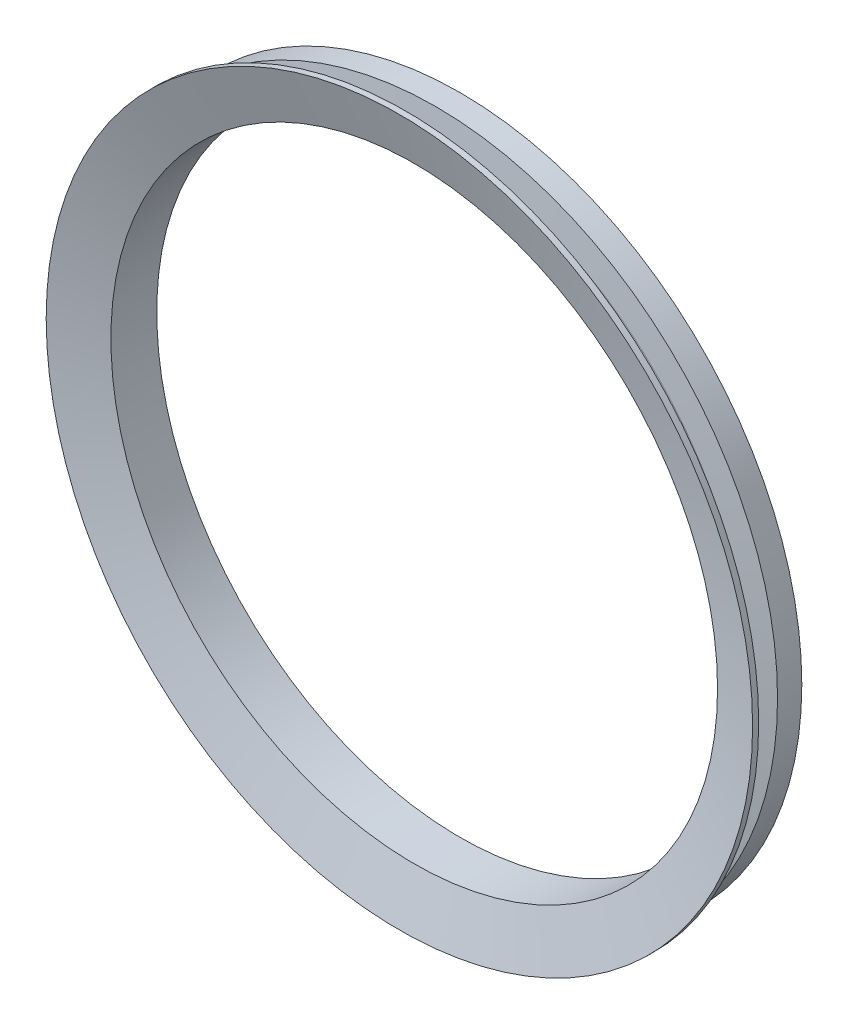
from build123d import *


with BuildPart() as part:
    # Sketch1 → Revolve1 (revolve)
    with BuildSketch(Plane(origin=(0, 0, 0), x_dir=(0, 0, -1), z_dir=(1, 0, 0))):
        with BuildLine():
            Line((-9, 52.4), (-8.1, 52.4))
            Line((-8.1, 52.4), (-5.961624878, 46.638267033))
            ThreePointArc((-5.961624878, 46.638267033), (-4.902735476, 45.99360404), (-4.030378188, 46.87441611))
            Line((-4.030378188, 46.87441611), (-3.6, 50.7))
            Line((-3.6, 50.7), (0, 50.7))
            Line((0, 50.7), (0, 45))
            Line((0, 45), (-6.8, 45))
            Line((-6.8, 45), (-9, 52.4))
        make_face()
    revolve(axis=Axis((0, 0, 0), (0, 0, -1)))


solid = part.part
